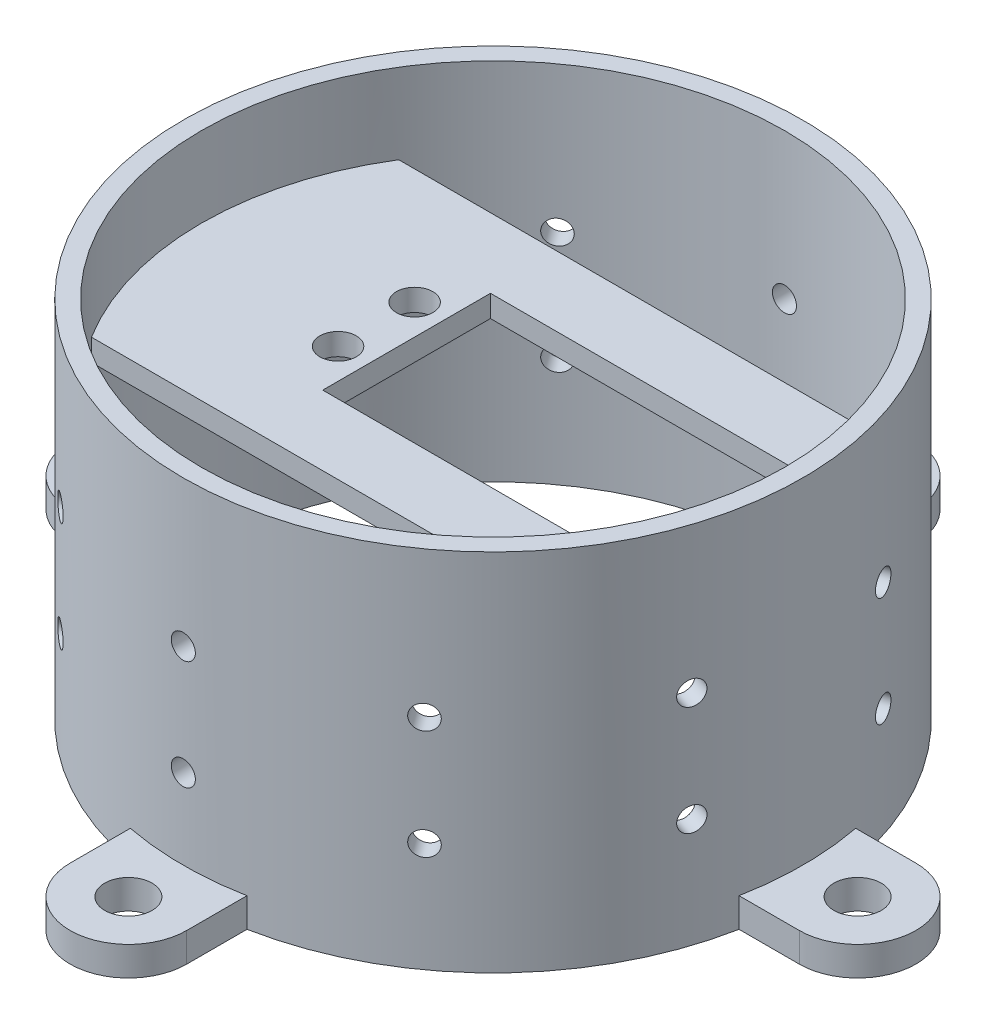
from build123d import *

# Parameters (mm, degrees)
SKETCH1_R                      = 42.5
SKETCH1_R_2                    = 40
BOSS_EXTRUDE1_DEPTH            = 50
SKETCH2_R                      = 3.25
BOSS_EXTRUDE2_DEPTH            = 4
CIRPATTERN1_COUNT              = 4
BOSS_EXTRUDE3_DEPTH            = 3
CUT_EXTRUDE1_REACH             = 92.824
SKETCH3_R                      = 2.5
SKETCH3_W                      = 42
SKETCH3_H                      = 23
CUT_EXTRUDE2_REACH             = 98.063
SKETCH6_R                      = 1.65
CUT_EXTRUDE2_DIRECTION_2_REACH = 98.063
CIRPATTERN2_COUNT              = 6
CIRPATTERN2_ANGLE              = 180


with BuildPart() as part:
    # Sketch1 → Boss-Extrude1 (new body)
    with BuildSketch(Plane(origin=(0, 0, 0), x_dir=(1, 0, 0), z_dir=(0, 1, 0))):
        Circle(SKETCH1_R)
        Circle(SKETCH1_R_2, mode=Mode.SUBTRACT)
    extrude(amount=BOSS_EXTRUDE1_DEPTH)

    # Sketch2 → Boss-Extrude2 (add)
    with BuildSketch(Plane.XZ):
        with BuildLine():
            Line((50.000268327, 8), (41.740268327, 8))
            ThreePointArc((41.740268327, 8), (42.309640768, 4.017996771), (42.5, 0))
            ThreePointArc((42.5, 0), (42.309640768, -4.017996771), (41.740268327, -8))
            Line((41.740268327, -8), (50.000268327, -8))
            ThreePointArc((50.000268327, -8), (58.000268327, 0), (50.000268327, 8))
        make_face()
        with Locations((50.000268327, 0)):
            Circle(SKETCH2_R, mode=Mode.SUBTRACT)
    boss_extrude2 = extrude(amount=-BOSS_EXTRUDE2_DEPTH)

    # CirPattern1: Boss-Extrude2 ×4 about axis
    cirpattern1_axis = Axis((0, 0, 0), (0, 1, 0))
    for i in range(1, CIRPATTERN1_COUNT):
        add(boss_extrude2.rotate(cirpattern1_axis, i * 360 / CIRPATTERN1_COUNT))

    # Sketch4 → Boss-Extrude3 (add)
    with BuildSketch(Plane(origin=(0, 36, 0), x_dir=(1, 0, 0), z_dir=(0, 1, 0))):
        with BuildLine():
            Line((34, -21.071307506), (-34, -21.071307506))
            ThreePointArc((-34, -21.071307506), (-40, 0), (-34, 21.071307506))
            Line((-34, 21.071307506), (34, 21.071307506))
            ThreePointArc((34, 21.071307506), (40, 0), (34, -21.071307506))
        make_face()
    extrude(amount=BOSS_EXTRUDE3_DEPTH)

    # Sketch3 → Cut-Extrude1 (cut, up to next)
    with BuildSketch(Plane(origin=(0, 39, 0), x_dir=(1, 0, 0), z_dir=(0, 1, 0)), mode=Mode.PRIVATE) as cut_extrude1_sk1:
        with Locations((34.300268327, 5.25)):
            Circle(SKETCH3_R)
    cut_extrude1_tool1 = extrude(cut_extrude1_sk1.sketch, amount=-CUT_EXTRUDE1_REACH, mode=Mode.PRIVATE) & part.part
    # Sketch3 → Cut-Extrude1 (cut, up to next)
    with BuildSketch(Plane(origin=(0, 39, 0), x_dir=(1, 0, 0), z_dir=(0, 1, 0)), mode=Mode.PRIVATE) as cut_extrude1_sk2:
        with Locations((34.300268327, -5.25)):
            Circle(SKETCH3_R)
    cut_extrude1_tool2 = extrude(cut_extrude1_sk2.sketch, amount=-CUT_EXTRUDE1_REACH, mode=Mode.PRIVATE) & part.part
    # Sketch3 → Cut-Extrude1 (cut, up to next)
    with BuildSketch(Plane(origin=(0, 39, 0), x_dir=(1, 0, 0), z_dir=(0, 1, 0)), mode=Mode.PRIVATE) as cut_extrude1_sk3:
        with Locations((-15.999731673, -5.25)):
            Circle(SKETCH3_R)
    cut_extrude1_tool3 = extrude(cut_extrude1_sk3.sketch, amount=-CUT_EXTRUDE1_REACH, mode=Mode.PRIVATE) & part.part
    # Sketch3 → Cut-Extrude1 (cut, up to next)
    with BuildSketch(Plane(origin=(0, 39, 0), x_dir=(1, 0, 0), z_dir=(0, 1, 0)), mode=Mode.PRIVATE) as cut_extrude1_sk4:
        with Locations((-15.999731673, 5.25)):
            Circle(SKETCH3_R)
    cut_extrude1_tool4 = extrude(cut_extrude1_sk4.sketch, amount=-CUT_EXTRUDE1_REACH, mode=Mode.PRIVATE) & part.part
    # Sketch3 → Cut-Extrude1 (cut, up to next)
    with BuildSketch(Plane(origin=(0, 39, 0), x_dir=(1, 0, 0), z_dir=(0, 1, 0)), mode=Mode.PRIVATE) as cut_extrude1_sk5:
        with Locations((9.150268327, 0)):
            Rectangle(SKETCH3_W, SKETCH3_H)
    cut_extrude1_tool5 = extrude(cut_extrude1_sk5.sketch, amount=-CUT_EXTRUDE1_REACH, mode=Mode.PRIVATE) & part.part
    add(cut_extrude1_tool1.solids().sort_by_distance((34.300268, 39, -5.25))[0], mode=Mode.SUBTRACT)
    add(cut_extrude1_tool2.solids().sort_by_distance((34.300268, 39, 5.25))[0], mode=Mode.SUBTRACT)
    add(cut_extrude1_tool3.solids().sort_by_distance((-15.999732, 39, 5.25))[0], mode=Mode.SUBTRACT)
    add(cut_extrude1_tool4.solids().sort_by_distance((-15.999732, 39, -5.25))[0], mode=Mode.SUBTRACT)
    add(cut_extrude1_tool5.solids().sort_by_distance((9.150268, 39, 0))[0], mode=Mode.SUBTRACT)

    # Sketch6 → Cut-Extrude2 (cut, up to next)
    with BuildSketch(Plane.XY, mode=Mode.PRIVATE) as cut_extrude2_sk1:
        with Locations((0, 15)):
            Circle(SKETCH6_R)
    cut_extrude2_tool1 = extrude(cut_extrude2_sk1.sketch, amount=-CUT_EXTRUDE2_REACH, mode=Mode.PRIVATE) & part.part
    # Sketch6 → Cut-Extrude2 (cut, up to next)
    with BuildSketch(Plane.XY, mode=Mode.PRIVATE) as cut_extrude2_sk2:
        with Locations((0, 30)):
            Circle(SKETCH6_R)
    cut_extrude2_tool2 = extrude(cut_extrude2_sk2.sketch, amount=-CUT_EXTRUDE2_REACH, mode=Mode.PRIVATE) & part.part
    cut_extrude2_1 = cut_extrude2_tool1.solids().sort_by_distance((0, 15, 0))[0]
    add(cut_extrude2_1, mode=Mode.SUBTRACT)
    cut_extrude2_2 = cut_extrude2_tool2.solids().sort_by_distance((0, 30, 0))[0]
    add(cut_extrude2_2, mode=Mode.SUBTRACT)
    cut_extrude2 = cut_extrude2_1 + cut_extrude2_2  # Cut-Extrude2 as one shape, for the pattern or mirror that repeats it

    # Sketch6 → Cut-Extrude2 direction 2 (cut, up to next)
    with BuildSketch(Plane.XY, mode=Mode.PRIVATE) as cut_extrude2_direction_2_sk1:
        with Locations((0, 15)):
            Circle(SKETCH6_R)
    cut_extrude2_direction_2_tool1 = extrude(cut_extrude2_direction_2_sk1.sketch, amount=CUT_EXTRUDE2_DIRECTION_2_REACH, mode=Mode.PRIVATE) & part.part
    # Sketch6 → Cut-Extrude2 direction 2 (cut, up to next)
    with BuildSketch(Plane.XY, mode=Mode.PRIVATE) as cut_extrude2_direction_2_sk2:
        with Locations((0, 30)):
            Circle(SKETCH6_R)
    cut_extrude2_direction_2_tool2 = extrude(cut_extrude2_direction_2_sk2.sketch, amount=CUT_EXTRUDE2_DIRECTION_2_REACH, mode=Mode.PRIVATE) & part.part
    cut_extrude2_direction_2_1 = cut_extrude2_direction_2_tool1.solids().sort_by_distance((0, 15, 0))[0]
    add(cut_extrude2_direction_2_1, mode=Mode.SUBTRACT)
    cut_extrude2_direction_2_2 = cut_extrude2_direction_2_tool2.solids().sort_by_distance((0, 30, 0))[0]
    add(cut_extrude2_direction_2_2, mode=Mode.SUBTRACT)
    cut_extrude2_direction_2 = cut_extrude2_direction_2_1 + cut_extrude2_direction_2_2  # Cut-Extrude2 direction 2 as one shape, for the pattern or mirror that repeats it

    # CirPattern2: Cut-Extrude2, Cut-Extrude2 direction 2 ×6 about axis
    cirpattern2_axis = Axis((0, 50, 0), (0, 1, 0))
    add([cut_extrude2.rotate(cirpattern2_axis, i * CIRPATTERN2_ANGLE / (CIRPATTERN2_COUNT - 1)) for i in range(1, CIRPATTERN2_COUNT)], mode=Mode.SUBTRACT)
    add([cut_extrude2_direction_2.rotate(cirpattern2_axis, i * CIRPATTERN2_ANGLE / (CIRPATTERN2_COUNT - 1)) for i in range(1, CIRPATTERN2_COUNT)], mode=Mode.SUBTRACT)


solid = part.part
